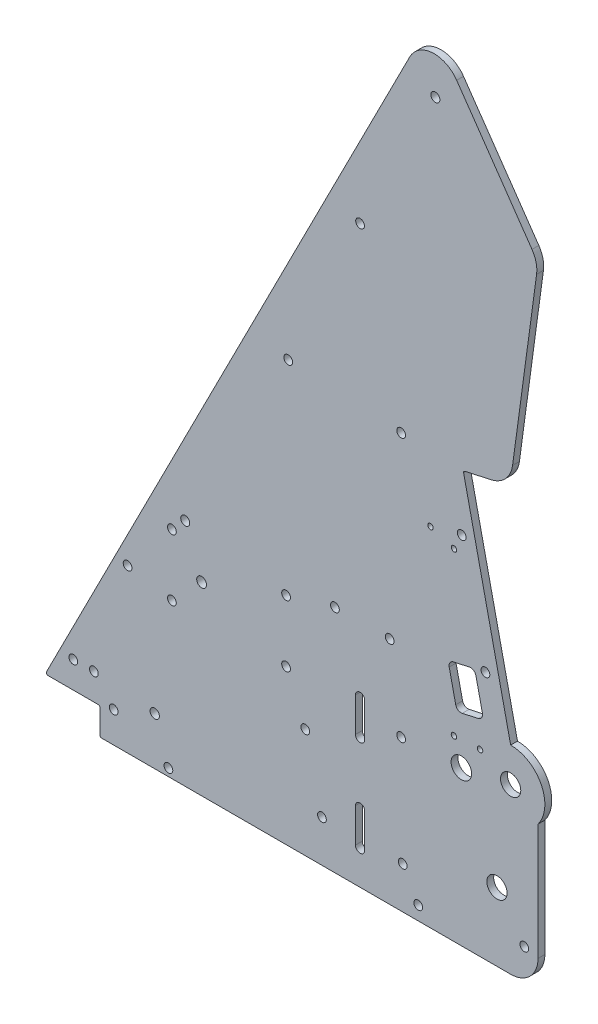
from build123d import *

# Parameters (mm, degrees)
BOSS_EXTRUDE1_DEPTH     = 3.175
SKETCH2_R               = 2.0955
SKETCH2_R_2             = 2.286
SKETCH2_R_3             = 2.032
SKETCH2_R_4             = 4.699
CUT_EXTRUDE1_DEPTH      = 421.976111717
SKETCH7_R               = 2.159
CUT_EXTRUDE2_DEPTH      = 421.976111717
CUT_EXTRUDE3_REACH      = 422.976
SKETCH10_R              = 2.032
FILLET1_R               = 12.7
FILLET2_R               = 0.79375
SKETCH12_R              = 2.032
CUT_EXTRUDE5_DEPTH      = 411.989226146
SKETCH13_R              = 2.032
CUT_EXTRUDE6_DEPTH      = 411.989226146
CUT_EXTRUDE7_DEPTH      = 411.989226146
CUT_EXTRUDE7_DEPTH_BACK = 411.989226146
SKETCH14_R              = 1.27
SKETCH14_R_2            = 2.032
FILLET3_R               = 2.54
SKETCH15_R              = 4.7625
CUT_EXTRUDE8_DEPTH      = 411.989226146


with BuildPart() as part:
    # Sketch1 → Boss-Extrude1 (new body)
    with BuildSketch(Plane.XY):
        with BuildLine():
            Line((228.6, -12.7), (228.6, 53.975))
            ThreePointArc((228.6, 53.975), (230.099031657, 70.599515829), (215.9, 79.375))
            Line((215.9, 79.375), (193.909735224, 178.566674323))
            Line((193.909735224, 178.566674323), (215.607913982, 183.377044743))
            Line((215.607913982, 183.377044743), (228.6, 279.4))
            Line((228.6, 279.4), (178.754725958, 351.413083686))
            Line((178.754725958, 351.413083686), (0, 0))
            Line((0, 0), (25.4, 0))
            Line((25.4, 0), (25.4, -12.7))
            Line((25.4, -12.7), (228.6, -12.7))
        make_face()
    extrude(amount=BOSS_EXTRUDE1_DEPTH)

    # Sketch2 → Cut-Extrude1 (cut, through all)
    with BuildSketch(Plane.XY.offset(3.175)):
        with Locations((64.943150167, 94.057839899)):
            Circle(SKETCH2_R)
        with Locations((180.975, 322.164313376)):
            Circle(SKETCH2_R)
        with Locations((72.544547852, 73.173171402)):
            Circle(SKETCH2_R_2)
        with Locations((193.207821773, 152.394364194)):
            Circle(SKETCH2_R_3)
        with Locations((215.9, 63.5)):
            Circle(SKETCH2_R_4)
        with Locations((173.0375, -6.35)):
            Circle(SKETCH2_R_3)
        with Locations((204.202954161, 102.798527032)):
            Circle(SKETCH2_R_3)
        with Locations((209.55, 19.05)):
            Circle(SKETCH2_R_4)
        with Locations((165.1, 179.3875)):
            Circle(SKETCH2_R_3)
        with Locations((111.724047852, 87.460671402)):
            Circle(SKETCH2_R_3)
        with Locations((111.724047852, 58.885671402)):
            Circle(SKETCH2_R_3)
        with Locations((58.765047852, 58.885671402)):
            Circle(SKETCH2_R_3)
        with Locations((58.765047852, 87.460671402)):
            Circle(SKETCH2_R_3)
    extrude(amount=-CUT_EXTRUDE1_DEPTH, mode=Mode.SUBTRACT)

    # Sketch7 → Cut-Extrude2 (cut, through all)
    with BuildSketch(Plane.XY.offset(3.175)):
        with Locations((50.8, 9.525)):
            Circle(SKETCH7_R)
        with BuildLine():
            Line((143.891, 3.175), (143.891, 19.05))
            ThreePointArc((143.891, 19.05), (146.05, 21.209), (148.209, 19.05))
            Line((148.209, 19.05), (148.209, 3.175))
            ThreePointArc((148.209, 3.175), (146.05, 1.016), (143.891, 3.175))
        make_face()
        with BuildLine():
            Line((143.891, 47.625), (143.891, 63.5))
            ThreePointArc((143.891, 63.5), (146.05, 65.659), (148.209, 63.5))
            Line((148.209, 63.5), (148.209, 47.625))
            ThreePointArc((148.209, 47.625), (146.05, 45.466), (143.891, 47.625))
        make_face()
    extrude(amount=-CUT_EXTRUDE2_DEPTH, mode=Mode.SUBTRACT)

    # Sketch10 → Cut-Extrude3 (cut, up to next)
    with BuildSketch(Plane.XY.offset(3.175), mode=Mode.PRIVATE) as cut_extrude3_sk1:
        with Locations((120.65, 38.1)):
            Circle(SKETCH10_R)
    cut_extrude3_tool1 = extrude(cut_extrude3_sk1.sketch, amount=-CUT_EXTRUDE3_REACH, mode=Mode.PRIVATE) & part.part
    # Sketch10 → Cut-Extrude3 (cut, up to next)
    with BuildSketch(Plane.XY.offset(3.175), mode=Mode.PRIVATE) as cut_extrude3_sk2:
        with Locations((165.1, 57.15)):
            Circle(SKETCH10_R)
    cut_extrude3_tool2 = extrude(cut_extrude3_sk2.sketch, amount=-CUT_EXTRUDE3_REACH, mode=Mode.PRIVATE) & part.part
    # Sketch10 → Cut-Extrude3 (cut, up to next)
    with BuildSketch(Plane.XY.offset(3.175), mode=Mode.PRIVATE) as cut_extrude3_sk3:
        with Locations((13.046467246, 12.334704411)):
            Circle(SKETCH10_R)
    cut_extrude3_tool3 = extrude(cut_extrude3_sk3.sketch, amount=-CUT_EXTRUDE3_REACH, mode=Mode.PRIVATE) & part.part
    # Sketch10 → Cut-Extrude3 (cut, up to next)
    with BuildSketch(Plane.XY.offset(3.175), mode=Mode.PRIVATE) as cut_extrude3_sk4:
        with Locations((22.571467246, 12.334704411)):
            Circle(SKETCH10_R)
    cut_extrude3_tool4 = extrude(cut_extrude3_sk4.sketch, amount=-CUT_EXTRUDE3_REACH, mode=Mode.PRIVATE) & part.part
    # Sketch10 → Cut-Extrude3 (cut, up to next)
    with BuildSketch(Plane.XY.offset(3.175), mode=Mode.PRIVATE) as cut_extrude3_sk5:
        with Locations((38.211447917, 62.639810909)):
            Circle(SKETCH10_R)
    cut_extrude3_tool5 = extrude(cut_extrude3_sk5.sketch, amount=-CUT_EXTRUDE3_REACH, mode=Mode.PRIVATE) & part.part
    add(cut_extrude3_tool1.solids().sort_by_distance((120.65, 38.1, 3.175))[0], mode=Mode.SUBTRACT)
    add(cut_extrude3_tool2.solids().sort_by_distance((165.1, 57.15, 3.175))[0], mode=Mode.SUBTRACT)
    add(cut_extrude3_tool3.solids().sort_by_distance((13.046467, 12.334704, 3.175))[0], mode=Mode.SUBTRACT)
    add(cut_extrude3_tool4.solids().sort_by_distance((22.571467, 12.334704, 3.175))[0], mode=Mode.SUBTRACT)
    add(cut_extrude3_tool5.solids().sort_by_distance((38.211448, 62.639811, 3.175))[0], mode=Mode.SUBTRACT)

    # Fillet1
    fillet1_edges = [part.edges().sort_by_distance(p)[0] for p in [
        (228.6, -12.7, 1.5875),
        (178.754725958, 351.413083686, 1.5875),
        (215.607913982, 183.377044743, 1.5875),
        (228.6, 279.4, 1.5875),
    ]]
    fillet(fillet1_edges, radius=FILLET1_R)

    # Fillet2
    fillet2_edges = [part.edges().sort_by_distance(p)[0] for p in [
        (25.4, -12.7, 1.5875),
        (25.4, 0, 1.5875),
        (193.909735224, 178.566674323, 1.5875),
        (0, 0, 1.5875),
    ]]
    fillet(fillet2_edges, radius=FILLET2_R)

    # Sketch12 → Cut-Extrude5 (cut, through all)
    with BuildSketch(Plane.XY.offset(3.175)):
        with Locations((31.75, 1.5875)):
            Circle(SKETCH12_R)
        with Locations((173.0375, -6.35)):
            Circle(SKETCH12_R)
        with Locations((222.25, 1.5875)):
            Circle(SKETCH12_R)
        with Locations((57.15, -9.2075)):
            Circle(SKETCH12_R)
    extrude(amount=-CUT_EXTRUDE5_DEPTH, mode=Mode.SUBTRACT)

    # Sketch13 → Cut-Extrude6 (cut, through all)
    with BuildSketch(Plane.XY.offset(3.175)):
        with Locations((112.7125, 182.5625)):
            Circle(SKETCH13_R)
        with Locations((146.05, 254)):
            Circle(SKETCH13_R)
    extrude(amount=-CUT_EXTRUDE6_DEPTH, mode=Mode.SUBTRACT)

    # Sketch14 → Cut-Extrude7 (cut, two sides: drawn at the far end of the back side and taken through both)
    with BuildSketch(Plane.XY.offset(3.175).offset(-CUT_EXTRUDE7_DEPTH_BACK)):
        with Locations((189.602197334, 69.980636704)):
            Circle(SKETCH14_R)
        with Locations((201.708862449, 70.509225118)):
            Circle(SKETCH14_R)
        with Locations((159.793547852, 93.98)):
            Circle(SKETCH14_R_2)
        with Locations((134.393547852, 93.98)):
            Circle(SKETCH14_R_2)
        with Locations((178.721644858, 148.532438598)):
            Circle(SKETCH14_R)
        with Locations((189.622629605, 145.09537131)):
            Circle(SKETCH14_R)
        with Locations((128.361047852, 6.6675)):
            Circle(SKETCH14_R_2)
        with Locations((165.826047852, 6.6675)):
            Circle(SKETCH14_R_2)
        Polygon((186.844411154, 98.950230697), (199.243370445, 101.699013794), (203.36654509, 83.100574858), (190.9675858, 80.351791761), align=None)
    extrude(amount=CUT_EXTRUDE7_DEPTH + CUT_EXTRUDE7_DEPTH_BACK, mode=Mode.SUBTRACT)

    # Fillet3
    fillet3_edges = [part.edges().sort_by_distance(p)[0] for p in [
        (199.243370445, 101.699013794, 1.5875),
        (186.844411154, 98.950230697, 1.5875),
        (190.9675858, 80.351791761, 1.5875),
        (203.36654509, 83.100574858, 1.5875),
    ]]
    fillet(fillet3_edges, radius=FILLET3_R)

    # Sketch15 → Cut-Extrude8 (cut, through all)
    with BuildSketch(Plane.XY.offset(3.175)):
        with Locations((193.04, 58.801)):
            Circle(SKETCH15_R)
    extrude(amount=-CUT_EXTRUDE8_DEPTH, mode=Mode.SUBTRACT)


solid = part.part
